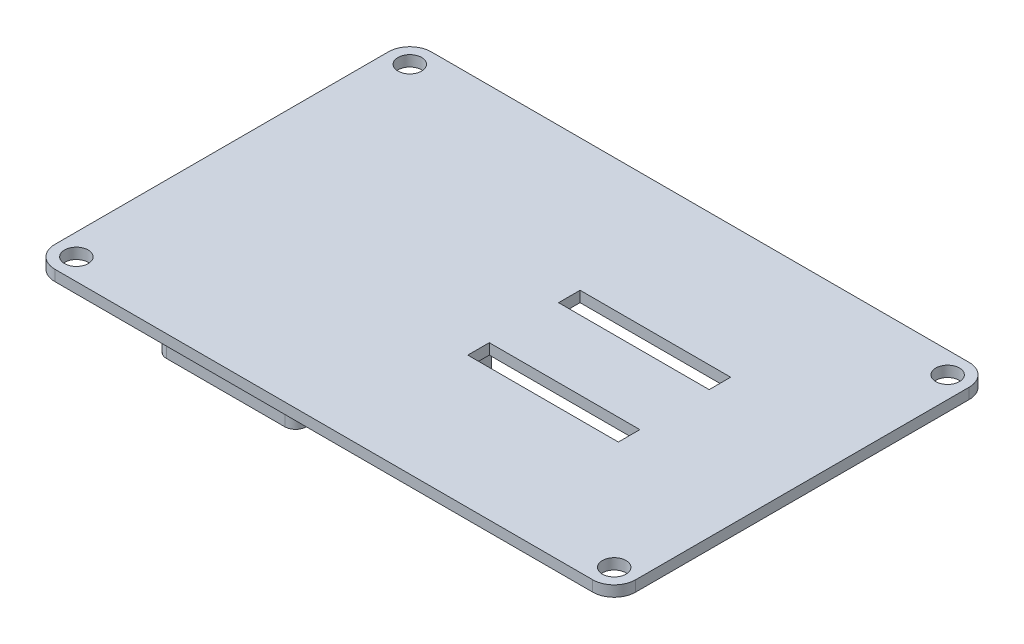
from build123d import *

# Parameters (mm, degrees)
SKETCH1_W                    = 137.16
SKETCH1_H                    = 88.9
BOSS_EXTRUDE2_DEPTH          = 2.54
SKETCH2_R                    = 2.794
CUT_EXTRUDE1_DEPTH           = 5.08
SKETCH9_W                    = 35.56
SKETCH9_H                    = 5.08
CUT_EXTRUDE5_DEPTH           = 6.35
SKETCH8_W                    = 33.02
SKETCH8_H                    = 53.34
BOSS_EXTRUDE4_DEPTH          = 21.59
SHELL4_T                     = -2.54
SKETCH13_W                   = 24.612851837
SKETCH13_H                   = 14.097856124
CUT_EXTRUDE6_DEPTH           = 5.08
FILLET5_R                    = 2.54
FILLET6_R                    = 2.54
FILLET7_R                    = 2.54
FILLET8_R                    = 2.54
FILLET1_R                    = 5.08
FILLET2_R                    = 5.08
FILLET3_R                    = 5.08
FILLET4_R                    = 5.08
FILLET9_R                    = 2.54
FILLET10_R                   = 2.54
FILLET11_R                   = 2.54
FILLET12_R                   = 2.54
SKETCH17_R                   = 3.175
BOSS_EXTRUDE5_DEPTH          = 7.62
SKETCH18_R                   = 1.651
CUT_EXTRUDE7_DEPTH           = 5.08
CUT_EXTRUDE7_DRAFT           = -2
CUT_EXTRUDE7_PROFILE_2_DEPTH = 5.08
CUT_EXTRUDE7_PROFILE_2_DRAFT = -2
CUT_EXTRUDE7_PROFILE_3_DEPTH = 5.08
CUT_EXTRUDE7_PROFILE_3_DRAFT = -2
CUT_EXTRUDE7_PROFILE_4_DEPTH = 5.08
CUT_EXTRUDE7_PROFILE_4_DRAFT = -2


with BuildPart() as part:
    # Sketch1 → Boss-Extrude2 (new body)
    with BuildSketch(Plane(origin=(0, 0, 0), x_dir=(1, 0, 0), z_dir=(0, 1, 0))):
        Rectangle(SKETCH1_W, SKETCH1_H)
    extrude(amount=BOSS_EXTRUDE2_DEPTH)

    # Sketch2 → Cut-Extrude1 (cut)
    with BuildSketch(Plane(origin=(0, 0, 0), x_dir=(-1, 0, 0), z_dir=(0, -1, 0))):
        with Locations((63.5, 39.37)):
            Circle(SKETCH2_R)
        with Locations((63.5, -39.37)):
            Circle(SKETCH2_R)
        with Locations((-63.5, -39.37)):
            Circle(SKETCH2_R)
        with Locations((-63.5, 39.37)):
            Circle(SKETCH2_R)
    extrude(amount=-CUT_EXTRUDE1_DEPTH, mode=Mode.SUBTRACT)

    # Sketch9 → Cut-Extrude5 (cut)
    with BuildSketch(Plane(origin=(0, 0, 0), x_dir=(-1, 0, 0), z_dir=(0, -1, 0))):
        with Locations((-20.595526461, -10.719909337)):
            Rectangle(SKETCH9_W, SKETCH9_H)
        with Locations((-20.595526461, 10.719909337)):
            Rectangle(SKETCH9_W, SKETCH9_H)
    extrude(amount=-CUT_EXTRUDE5_DEPTH, mode=Mode.SUBTRACT)

    # Fillet1
    fillet1_edges = [part.edges().sort_by_distance(p)[0] for p in [
        (68.58, 1.27, 44.45),
    ]]
    fillet(fillet1_edges, radius=FILLET1_R)

    # Fillet2
    fillet2_edges = [part.edges().sort_by_distance(p)[0] for p in [
        (-68.58, 1.27, -44.45),
    ]]
    fillet(fillet2_edges, radius=FILLET2_R)

    # Fillet3
    fillet3_edges = [part.edges().sort_by_distance(p)[0] for p in [
        (-68.58, 1.27, 44.45),
    ]]
    fillet(fillet3_edges, radius=FILLET3_R)

    # Fillet4
    fillet4_edges = [part.edges().sort_by_distance(p)[0] for p in [
        (68.58, 1.27, -44.45),
    ]]
    fillet(fillet4_edges, radius=FILLET4_R)

    # Sketch17 → Boss-Extrude5 (add)
    with BuildSketch(Plane(origin=(0, 0, 0), x_dir=(-1, 0, 0), z_dir=(0, -1, 0))):
        with Locations((1.025141255, -8.255)):
            Circle(SKETCH17_R)
        with Locations((1.025141255, 37.465)):
            Circle(SKETCH17_R)
        with Locations((-44.694858745, 37.465)):
            Circle(SKETCH17_R)
        with Locations((-44.694858745, -8.255)):
            Circle(SKETCH17_R)
    extrude(amount=BOSS_EXTRUDE5_DEPTH)


with BuildPart() as body_2:
    # Sketch8 → Boss-Extrude4 (new body)
    with BuildSketch(Plane(origin=(0, 0, 0), x_dir=(-1, 0, 0), z_dir=(0, -1, 0))):
        with Locations((42.215940653, 1.27)):
            Rectangle(SKETCH8_W, SKETCH8_H)
    extrude(amount=BOSS_EXTRUDE4_DEPTH)

    # Shell4
    shell4_openings = [body_2.faces().sort_by_distance(p)[0] for p in [
        (-42.215940653, -21.59, -1.27),
    ]]
    offset(amount=SHELL4_T, openings=shell4_openings, kind=Kind.INTERSECTION)

    # Sketch13 → Cut-Extrude6 (cut)
    with BuildSketch(Plane(origin=(0, 0, -27.94), x_dir=(-1, 0, 0), z_dir=(0, 0, -1))):
        with Locations((42.215940653, -10.795)):
            Rectangle(SKETCH13_W, SKETCH13_H)
    extrude(amount=-CUT_EXTRUDE6_DEPTH, mode=Mode.SUBTRACT)

    # Fillet5
    fillet5_edges = [body_2.edges().sort_by_distance(p)[0] for p in [
        (-29.909514734, -17.843928062, -26.67),
    ]]
    fillet(fillet5_edges, radius=FILLET5_R)

    # Fillet6
    fillet6_edges = [body_2.edges().sort_by_distance(p)[0] for p in [
        (-29.909514734, -3.746071938, -26.67),
    ]]
    fillet(fillet6_edges, radius=FILLET6_R)

    # Fillet7
    fillet7_edges = [body_2.edges().sort_by_distance(p)[0] for p in [
        (-54.522366571, -3.746071938, -26.67),
    ]]
    fillet(fillet7_edges, radius=FILLET7_R)

    # Fillet8
    fillet8_edges = [body_2.edges().sort_by_distance(p)[0] for p in [
        (-54.522366571, -17.843928062, -26.67),
    ]]
    fillet(fillet8_edges, radius=FILLET8_R)

    # Fillet9
    fillet9_edges = [body_2.edges().sort_by_distance(p)[0] for p in [
        (-25.705940653, -10.795, -27.94),
    ]]
    fillet(fillet9_edges, radius=FILLET9_R)

    # Fillet10
    fillet10_edges = [body_2.edges().sort_by_distance(p)[0] for p in [
        (-25.705940653, -10.795, 25.4),
    ]]
    fillet(fillet10_edges, radius=FILLET10_R)

    # Fillet11
    fillet11_edges = [body_2.edges().sort_by_distance(p)[0] for p in [
        (-58.725940653, -10.795, 25.4),
    ]]
    fillet(fillet11_edges, radius=FILLET11_R)

    # Fillet12
    fillet12_edges = [body_2.edges().sort_by_distance(p)[0] for p in [
        (-58.725940653, -10.795, -27.94),
    ]]
    fillet(fillet12_edges, radius=FILLET12_R)


with BuildPart() as cut_extrude7_tool:
    # Sketch18 → Cut-Extrude7 (with draft: the straight prism first)
    with BuildSketch(Plane.XZ.offset(7.62)):
        with Locations((44.694858745, 8.255)):
            Circle(SKETCH18_R)
    extrude(amount=-CUT_EXTRUDE7_DEPTH)
    # Cut-Extrude7: the draft: its side faces are tilted about the plane it starts from
    cut_extrude7_sides = [cut_extrude7_tool.faces().sort_by_distance(p)[0] for p in [
        (43.043858745, -5.08, 8.255),
    ]]
    draft(cut_extrude7_sides, Plane.XZ.offset(7.62), CUT_EXTRUDE7_DRAFT)


with BuildPart() as part_1:
    add(part.part)

    # Cut-Extrude7: cut by cut_extrude7_tool
    add(cut_extrude7_tool.part, mode=Mode.SUBTRACT)


with BuildPart() as cut_extrude7_profile_2_tool:
    # Sketch18 → Cut-Extrude7 profile 2 (with draft: the straight prism first)
    with BuildSketch(Plane.XZ.offset(7.62)):
        with Locations((44.694858745, -37.465)):
            Circle(SKETCH18_R)
    extrude(amount=-CUT_EXTRUDE7_PROFILE_2_DEPTH)
    # Cut-Extrude7 profile 2: the draft: its side faces are tilted about the plane it starts from
    cut_extrude7_profile_2_sides = [cut_extrude7_profile_2_tool.faces().sort_by_distance(p)[0] for p in [
        (43.043858745, -5.08, -37.465),
    ]]
    draft(cut_extrude7_profile_2_sides, Plane.XZ.offset(7.62), CUT_EXTRUDE7_PROFILE_2_DRAFT)


with BuildPart() as part_2:
    add(part_1.part)

    # Cut-Extrude7 profile 2: cut by cut_extrude7_profile_2_tool
    add(cut_extrude7_profile_2_tool.part, mode=Mode.SUBTRACT)


with BuildPart() as cut_extrude7_profile_3_tool:
    # Sketch18 → Cut-Extrude7 profile 3 (with draft: the straight prism first)
    with BuildSketch(Plane.XZ.offset(7.62)):
        with Locations((-1.025141255, -37.465)):
            Circle(SKETCH18_R)
    extrude(amount=-CUT_EXTRUDE7_PROFILE_3_DEPTH)
    # Cut-Extrude7 profile 3: the draft: its side faces are tilted about the plane it starts from
    cut_extrude7_profile_3_sides = [cut_extrude7_profile_3_tool.faces().sort_by_distance(p)[0] for p in [
        (-2.676141255, -5.08, -37.465),
    ]]
    draft(cut_extrude7_profile_3_sides, Plane.XZ.offset(7.62), CUT_EXTRUDE7_PROFILE_3_DRAFT)


with BuildPart() as part_3:
    add(part_2.part)

    # Cut-Extrude7 profile 3: cut by cut_extrude7_profile_3_tool
    add(cut_extrude7_profile_3_tool.part, mode=Mode.SUBTRACT)


with BuildPart() as cut_extrude7_profile_4_tool:
    # Sketch18 → Cut-Extrude7 profile 4 (with draft: the straight prism first)
    with BuildSketch(Plane.XZ.offset(7.62)):
        with Locations((-1.025141255, 8.255)):
            Circle(SKETCH18_R)
    extrude(amount=-CUT_EXTRUDE7_PROFILE_4_DEPTH)
    # Cut-Extrude7 profile 4: the draft: its side faces are tilted about the plane it starts from
    cut_extrude7_profile_4_sides = [cut_extrude7_profile_4_tool.faces().sort_by_distance(p)[0] for p in [
        (-2.676141255, -5.08, 8.255),
    ]]
    draft(cut_extrude7_profile_4_sides, Plane.XZ.offset(7.62), CUT_EXTRUDE7_PROFILE_4_DRAFT)


with BuildPart() as part_4:
    add(part_3.part)

    # Cut-Extrude7 profile 4: cut by cut_extrude7_profile_4_tool
    add(cut_extrude7_profile_4_tool.part, mode=Mode.SUBTRACT)


solid = Compound([body_2.part, part_4.part])
